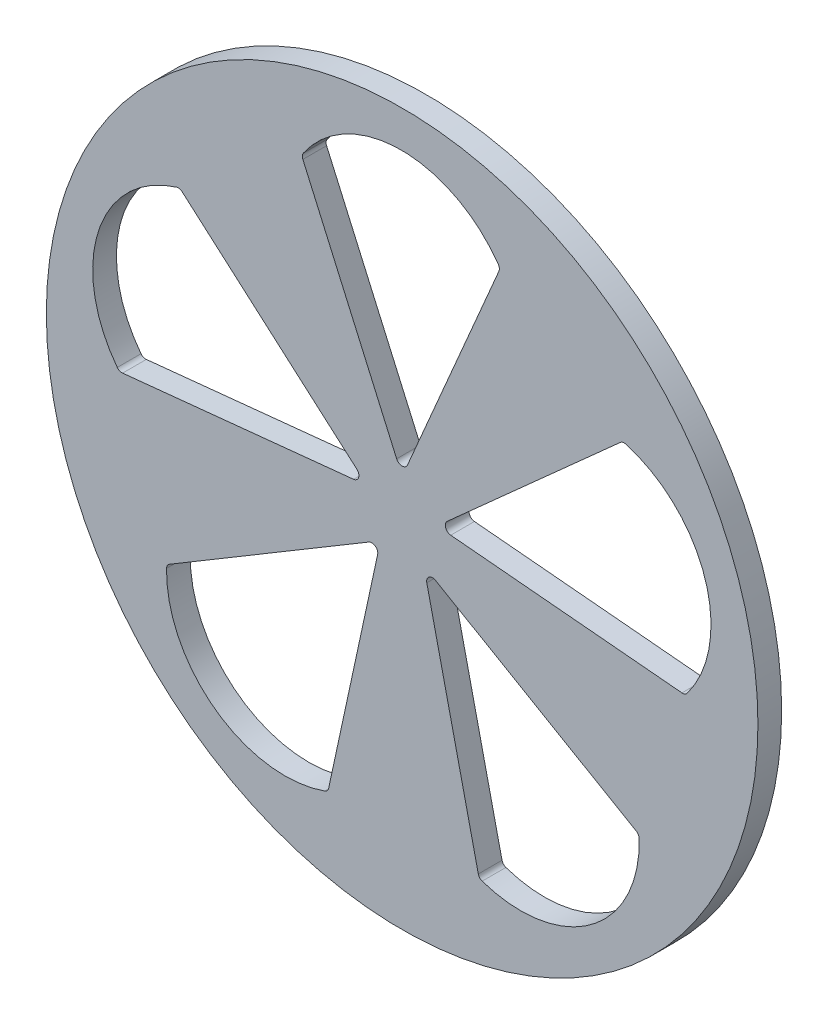
from build123d import *

# Parameters (mm, degrees)
ESQUISSE1_R        = 30
BOSS_EXTRU_1_DEPTH = 2
CONG_1_R           = 0.5


with BuildPart() as part:
    # Esquisse1 → Boss.-Extru.1 (new body)
    with BuildSketch(Plane.XY):
        Circle(ESQUISSE1_R)
        with BuildLine():
            Line((0, 3.101464628), (8.266251242, 22.406103719))
            ThreePointArc((8.266251242, 22.406103719), (-0.132620691, 26.89303802), (-8.480949466, 22.312750274))
            Line((-8.480949466, 22.312750274), (0, 3.101464628))
        make_face(mode=Mode.SUBTRACT)
        with BuildLine():
            Line((18.599929031, 14.96088128), (2.949668145, 0.958405278))
            Line((2.949668145, 0.958405278), (23.86388306, -0.937805282))
            ThreePointArc((23.86388306, -0.937805282), (25.535817005, 8.436535551), (18.599929031, 14.96088128))
        make_face(mode=Mode.SUBTRACT)
        with BuildLine():
            Line((19.976337796, -13.066417141), (1.822995169, -2.509137592))
            Line((1.822995169, -2.509137592), (6.482439593, -22.985699258))
            ThreePointArc((6.482439593, -22.985699258), (15.914623531, -21.678972302), (19.976337796, -13.066417141))
        make_face(mode=Mode.SUBTRACT)
        with BuildLine():
            Line((-6.253873302, -23.036371184), (-1.822995169, -2.509137592))
            Line((-1.822995169, -2.509137592), (-19.857515061, -13.268138114))
            ThreePointArc((-19.857515061, -13.268138114), (-15.700038744, -21.834877275), (-6.253873302, -23.036371184))
        make_face(mode=Mode.SUBTRACT)
        with BuildLine():
            Line((-23.841444058, -1.170843229), (-2.949668145, 0.958405278))
            Line((-2.949668145, 0.958405278), (-18.755058833, 14.785538936))
            ThreePointArc((-18.755058833, 14.785538936), (-25.617781099, 8.184276006), (-23.841444058, -1.170843229))
        make_face(mode=Mode.SUBTRACT)
    extrude(amount=BOSS_EXTRU_1_DEPTH)

    # Congé1
    cong_1_edges = [part.edges().sort_by_distance(p)[0] for p in [
        (19.976337796, -13.066417141, 1),
        (18.599929031, 14.96088128, 1),
        (-18.755058833, 14.785538936, 1),
        (-19.857515061, -13.268138114, 1),
        (6.482439593, -22.985699258, 1),
        (-23.841444058, -1.170843229, 1),
        (-6.253873302, -23.036371184, 1),
        (23.86388306, -0.937805282, 1),
        (8.266251242, 22.406103719, 1),
        (-8.480949466, 22.312750274, 1),
        (0, 3.101464628, 1),
        (2.949668145, 0.958405278, 1),
        (1.822995169, -2.509137592, 1),
        (-1.822995169, -2.509137592, 1),
        (-2.949668145, 0.958405278, 1),
    ]]
    fillet(cong_1_edges, radius=CONG_1_R)


solid = part.part
